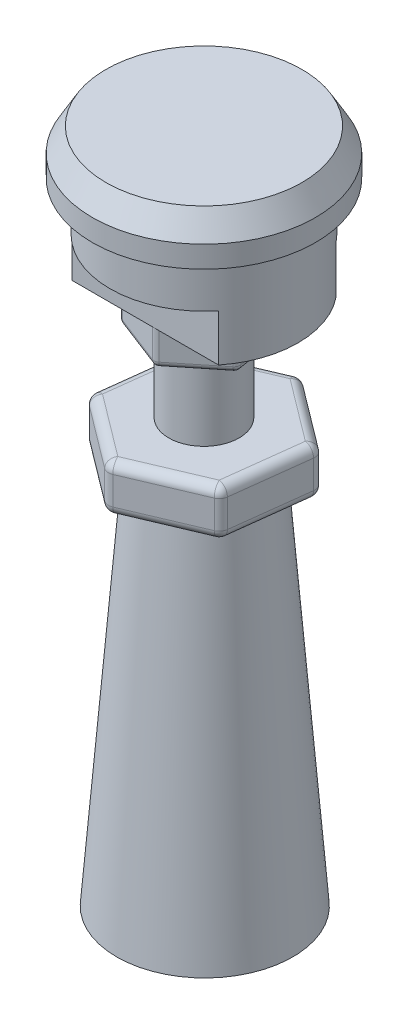
from build123d import *

# Parameters (mm, degrees)
SKETCH_1_R          = 8
EXTRUDE_2_DEPTH     = 7
CUT_EXTRUDE_1_DEPTH = 4
EXTRUDE_3_DEPTH     = 3
SKETCH_5_R          = 3
EXTRUDE_4_DEPTH     = 6.5
EXTRUDE_5_DEPTH     = 4
FILLET_1_R          = 0.5
FILLET_2_R          = 0.8
SKETCH_10_R         = 9.5
EXTRUDE_6_DEPTH     = 5
CHAMFER_1_SIZE      = 2
CHAMFER_1_SIZE2     = 1.154700538
CHAMFER_2_SIZE      = 1.154700538
CHAMFER_2_SIZE_2    = 2


with BuildPart() as part:
    # ｽｹｯﾁ1 → ﾎﾞｽ - 押し出し2 (new body)
    with BuildSketch(Plane(origin=(0, 0, 0), x_dir=(1, 0, 0), z_dir=(0, 1, 0))):
        with Locations(Location((0, 0, 0), (0, 0, 270))):
            Circle(SKETCH_1_R)
    extrude(amount=EXTRUDE_2_DEPTH)

    # ｽｹｯﾁ3 → ｶｯﾄ - 押し出し1 (cut)
    with BuildSketch(Plane.XZ):
        with BuildLine():
            Line((6.244997998, 5), (-6.244997998, 5))
            ThreePointArc((-6.244997998, 5), (0, 8), (6.244997998, 5))
        make_face()
        with BuildLine():
            Line((-6.244997998, -5), (6.244997998, -5))
            ThreePointArc((6.244997998, -5), (0, -8), (-6.244997998, -5))
        make_face()
    extrude(amount=-CUT_EXTRUDE_1_DEPTH, mode=Mode.SUBTRACT)

    # ｽｹｯﾁ4 → ﾎﾞｽ - 押し出し3 (add)
    with BuildSketch(Plane.XZ):
        Polygon((-0.778263218, -5), (3.94099541, -3.173995717), (4.719258628, 1.826004283), (0.778263218, 5), (-3.94099541, 3.173995717), (-4.719258628, -1.826004283), align=None)
    extrude(amount=EXTRUDE_3_DEPTH)

    # ｽｹｯﾁ5 → ﾎﾞｽ - 押し出し4 (add)
    with BuildSketch(Plane.XZ.offset(3)):
        with Locations(Location((0, 0, 0), (0, 0, 90))):
            Circle(SKETCH_5_R)
    extrude(amount=EXTRUDE_4_DEPTH)

    # ｽｹｯﾁ6 → ﾎﾞｽ - 押し出し5 (add)
    with BuildSketch(Plane.XZ.offset(9.5)):
        Polygon((-5.997049326, -4.513173242), (0.909998016, -7.450183685), (6.907047342, -2.937010444), (5.997049326, 4.513173242), (-0.909998016, 7.450183685), (-6.907047342, 2.937010444), align=None)
    extrude(amount=EXTRUDE_5_DEPTH)

    # ﾌｨﾚｯﾄ1
    fillet_1_edges = [part.edges().sort_by_distance(p)[0] for p in [
        (-4.719258628, -1.5, -1.826004283),
        (-0.778263218, -1.5, -5),
        (3.94099541, -1.5, -3.173995717),
        (4.719258628, -1.5, 1.826004283),
        (0.778263218, -1.5, 5),
        (-3.94099541, -1.5, 3.173995717),
        (-2.748760923, -3, -3.413002141),
        (1.581366096, -3, -4.086997859),
        (4.330127019, -3, -0.673995717),
        (2.748760923, -3, 3.413002141),
        (-1.581366096, -3, 4.086997859),
        (-4.330127019, -3, 0.673995717),
    ]]
    fillet(fillet_1_edges, radius=FILLET_1_R)

    # ﾌｨﾚｯﾄ2
    fillet_2_edges = [part.edges().sort_by_distance(p)[0] for p in [
        (-6.452048334, -9.5, -0.788081399),
        (-6.907047342, -11.5, 2.937010444),
        (-2.543525655, -9.5, -5.981678464),
        (-5.997049326, -11.5, -4.513173242),
        (3.908522679, -9.5, -5.193597064),
        (0.909998016, -11.5, -7.450183685),
        (6.452048334, -9.5, 0.788081399),
        (6.907047342, -11.5, -2.937010444),
        (2.543525655, -9.5, 5.981678464),
        (5.997049326, -11.5, 4.513173242),
        (-3.908522679, -9.5, 5.193597064),
        (-0.909998016, -11.5, 7.450183685),
        (-6.452048334, -13.5, -0.788081399),
        (-2.543525655, -13.5, -5.981678464),
        (3.908522679, -13.5, -5.193597064),
        (6.452048334, -13.5, 0.788081399),
        (2.543525655, -13.5, 5.981678464),
        (-3.908522679, -13.5, 5.193597064),
    ]]
    fillet(fillet_2_edges, radius=FILLET_2_R)

    # ｽｹｯﾁ10 → ﾎﾞｽ - 押し出し6 (add)
    with BuildSketch(Plane(origin=(0, 7, 0), x_dir=(1, 0, 0), z_dir=(0, 1, 0))):
        with Locations(Location((0, 0, 0), (0, 0, 270))):
            Circle(SKETCH_10_R)
    extrude(amount=EXTRUDE_6_DEPTH)

    # 面取り1
    chamfer_1_edges = [part.edges().sort_by_distance(p)[0] for p in [
        (0, 12, -9.5),
    ]]
    chamfer_1_side = [part.faces().sort_by_distance(p)[0] for p in [
        (0, 9.5, -9.5),
    ]]
    chamfer(chamfer_1_edges, length=CHAMFER_1_SIZE, length2=CHAMFER_1_SIZE2, reference=chamfer_1_side[0])

    # 面取り2
    # the kernel refuses this chamfer: 2, 1.154700538 mm, written as the material it takes off along each edge
    with BuildSketch(Plane(origin=(0, 7, 0), x_dir=(0, 0, 1), z_dir=(-1, 0, 0))) as chamfer_2_piece_1_section:
        Polygon((9.5, CHAMFER_2_SIZE), (9.5 - CHAMFER_2_SIZE_2, 0), (9.5, 0), align=None)
    chamfer_2_piece_1 = revolve(axis=Axis((0, 7, 0), (0, 1, 0)), mode=Mode.PRIVATE)
    chamfer_2_piece_1 = chamfer_2_piece_1 - Plane(origin=(0, 7.706438627, 0), x_dir=(0, 0, 1), z_dir=(0, -1, 0)) * Cylinder(8, 38, mode=Mode.PRIVATE)
    add(chamfer_2_piece_1, mode=Mode.SUBTRACT)


with BuildPart() as body_2:
    # ｽｹｯﾁ9 → 回転2 (revolve)
    with BuildSketch(Plane(origin=(0.030409715, 0, -0.039774666), x_dir=(-0.7944176401871007, 0, -0.607371890162492), z_dir=(-0.607371890162492, 0, 0.7944176401871008)), mode=Mode.PRIVATE) as revolve_2_sk:
        Polygon((0, 13.517274561), (-5, 13.517274561), (-7.5, 45.517274561), (0, 45.517274561), align=None)
    revolve(revolve_2_sk.sketch.rotate(Axis((0.030409715, -13.517274561, -0.039774666), (0, -1, 0)), 52.600284855), axis=Axis((0.030409715, -13.517274561, -0.039774666), (0, -1, 0)))


solid = Compound([part.part, body_2.part])
